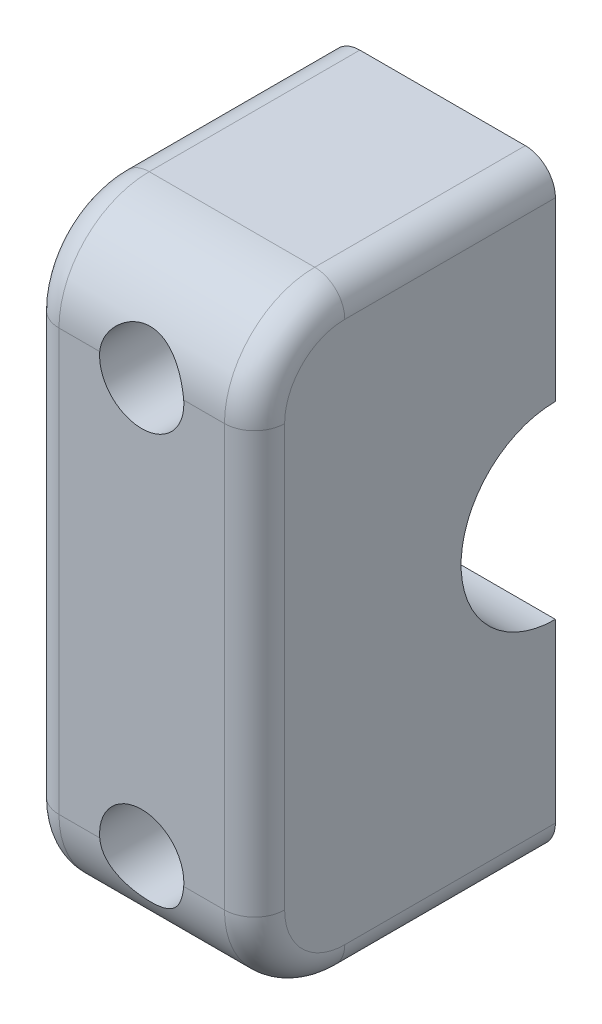
from build123d import *

# Parameters (mm, degrees)
SKETCH2_W           = 9.525
SKETCH2_H           = 25.4
BOSS_EXTRUDE1_DEPTH = 12.7
FILLET1_R           = 1.27
FILLET2_R           = 3.81
SKETCH15_R          = 3.981833791
CUT_EXTRUDE12_DEPTH = 55.150798834
SKETCH14_R          = 6.35
CUT_EXTRUDE13_DEPTH = 4.064
SKETCH17_R          = 1.778
CUT_EXTRUDE14_DEPTH = 56.155369014


with BuildPart() as part:
    # Sketch2 → Boss-Extrude1 (new body)
    with BuildSketch(Plane.XY):
        with Locations((9.39840893, -39.07155)):
            Rectangle(SKETCH2_W, SKETCH2_H)
    extrude(amount=BOSS_EXTRUDE1_DEPTH)

    # Fillet1
    fillet1_edges = [part.edges().sort_by_distance(p)[0] for p in [
        (4.63590893, -39.07155, 12.7),
        (14.16090893, -39.07155, 12.7),
        (4.63590893, -51.77155, 6.35),
        (4.63590893, -26.37155, 6.35),
        (14.16090893, -26.37155, 6.35),
        (14.16090893, -51.77155, 6.35),
    ]]
    fillet(fillet1_edges, radius=FILLET1_R)

    # Fillet2
    # the kernel refuses this fillet: 3.81 mm, written as the material it takes off along each edge
    with BuildSketch(Plane(origin=(14.16090893, -47.96155, 8.89), x_dir=(0, 0, 1), z_dir=(0, 1, 0))) as fillet2_piece_1:
        with BuildLine():
            CenterArc((2.54, -1.27), 1.27, 0, 90)
            Line((3.81, -1.27), (3.81, 0))
            Line((3.81, 0), (2.54, 0))
        make_face()
    revolve(axis=Axis((14.16090893, -47.96155, 8.89), (1, 0, 0)), revolution_arc=90, mode=Mode.SUBTRACT)
    with BuildSketch(Plane(origin=(14.16090893, -30.18155, 8.89), x_dir=(0, 1, 0), z_dir=(0, 0, -1))) as fillet2_piece_2:
        with BuildLine():
            CenterArc((2.54, -1.27), 1.27, 0, 90)
            Line((3.81, -1.27), (3.81, 0))
            Line((3.81, 0), (2.54, 0))
        make_face()
    revolve(axis=Axis((14.16090893, -30.18155, 8.89), (1, 0, 0)), revolution_arc=90, mode=Mode.SUBTRACT)
    with BuildSketch(Plane(origin=(4.63590893, -47.96155, 8.89), x_dir=(0, -1, 0), z_dir=(0, 0, -1))) as fillet2_piece_3:
        with BuildLine():
            CenterArc((2.54, -1.27), 1.27, 0, 90)
            Line((3.81, -1.27), (3.81, 0))
            Line((3.81, 0), (2.54, 0))
        make_face()
    revolve(axis=Axis((4.63590893, -47.96155, 8.89), (-1, 0, 0)), revolution_arc=90, mode=Mode.SUBTRACT)
    with BuildSketch(Plane(origin=(4.63590893, -30.18155, 8.89), x_dir=(0, 0, 1), z_dir=(0, -1, 0))) as fillet2_piece_4:
        with BuildLine():
            CenterArc((2.54, -1.27), 1.27, 0, 90)
            Line((3.81, -1.27), (3.81, 0))
            Line((3.81, 0), (2.54, 0))
        make_face()
    revolve(axis=Axis((4.63590893, -30.18155, 8.89), (-1, 0, 0)), revolution_arc=90, mode=Mode.SUBTRACT)
    with BuildSketch(Plane(origin=(14.16090893, -26.37155, 12.7), x_dir=(0, 0, -1), z_dir=(-1, 0, 0)), Plane(origin=(4.63590893, -51.77155, 12.7), x_dir=(0, 0, -1), z_dir=(1, 0, 0))) as fillet2_piece_5:
        with BuildLine():
            CenterArc((FILLET2_R, FILLET2_R), FILLET2_R, 180, 90)
            Line((0, FILLET2_R), (0, 0))
            Line((0, 0), (FILLET2_R, 0))
        make_face()
    extrude(amount=9.525, mode=Mode.SUBTRACT)

    # Sketch15 → Cut-Extrude12 (cut, through all)
    with BuildSketch(Plane.ZY.offset(-4.63590893)):
        with Locations((0, -39.07155)):
            Circle(SKETCH15_R)
    extrude(amount=-CUT_EXTRUDE12_DEPTH, mode=Mode.SUBTRACT)

    # Sketch14 → Cut-Extrude13 (cut)
    with BuildSketch(Plane.ZY.offset(-4.63590893)):
        with Locations((0, -39.07155)):
            Circle(SKETCH14_R)
    extrude(amount=-CUT_EXTRUDE13_DEPTH, mode=Mode.SUBTRACT)

    # Sketch17 → Cut-Extrude14 (cut, through all)
    with BuildSketch(Plane.XY.offset(12.7)):
        with Locations((9.39840893, -47.80915)):
            Circle(SKETCH17_R)
        with Locations((9.39840893, -30.33395)):
            Circle(SKETCH17_R)
    extrude(amount=-CUT_EXTRUDE14_DEPTH, mode=Mode.SUBTRACT)


solid = part.part
